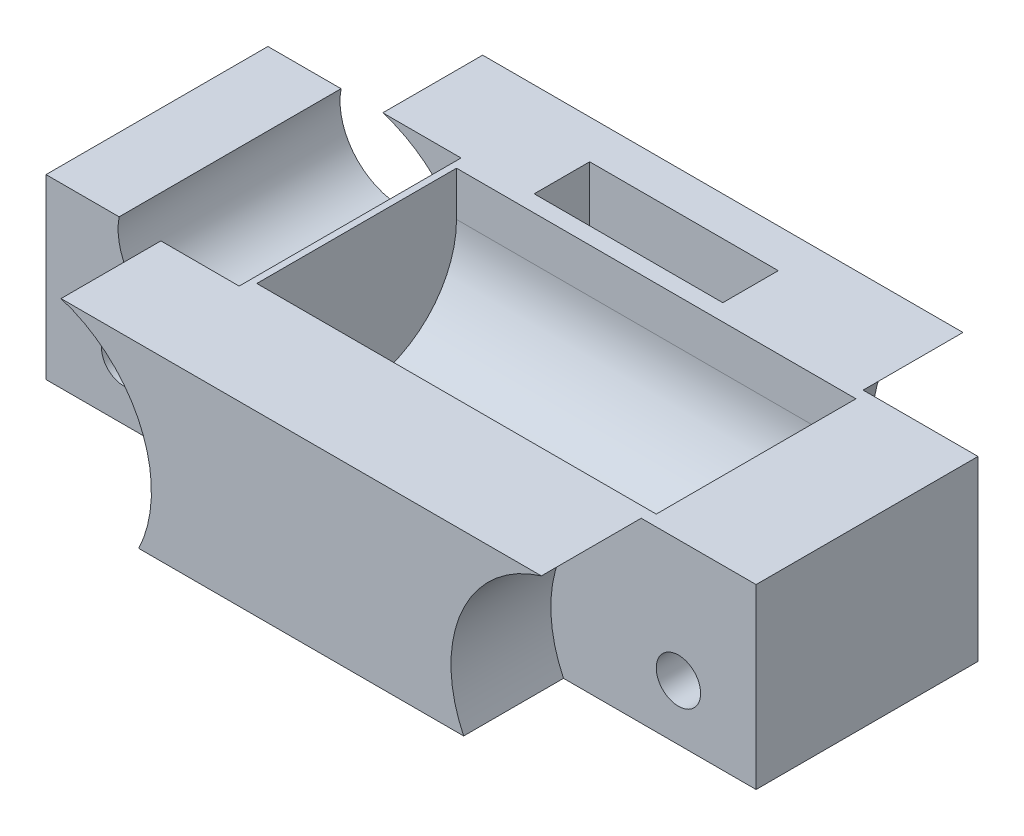
from build123d import *

# Parameters (mm, degrees)
SKETCH1_W               = 64
SKETCH1_H               = 38
BOSS_EXTRUDE1_DEPTH     = 16
CUT_EXTRUDE2_START      = 10
SKETCH3_R               = 11.5
CUT_EXTRUDE2_DEPTH      = 10
CUT_EXTRUDE3_DEPTH      = 41.509258201
CUT_EXTRUDE3_DEPTH_BACK = 41.509258201
SKETCH5_R               = 2
BATTERY_DEPTH           = 22
BATTERY_DEPTH_BACK      = 14
SKETCH4_R               = 9
CUT_EXTRUDE4_REACH      = 45.509
CUT_EXTRUDE4_START      = 3
SKETCH6_W               = 17
SKETCH6_H               = 5
SKETCH7_W               = 12
SKETCH7_H               = 8
CUT_EXTRUDE5_DEPTH      = 3
FILLET1_R               = 1.5
SKETCH8_R               = 5.5
CUT_EXTRUDE6_DEPTH      = 10


with BuildPart() as part:
    # Sketch1 → Boss-Extrude1 (new body)
    with BuildSketch(Plane(origin=(0, 0, 0), x_dir=(1, 0, 0), z_dir=(0, 1, 0))):
        Rectangle(SKETCH1_W, SKETCH1_H)
    extrude(amount=BOSS_EXTRUDE1_DEPTH)

    # Sketch3 → Cut-Extrude2 (cut)
    with BuildSketch(Plane.XY.offset(CUT_EXTRUDE2_START)):
        with BuildLine():
            Line((36.5, -6.5), (36.5, 5))
            ThreePointArc((36.5, 5), (33.131727984, -3.131727984), (25, -6.5))
            Line((25, -6.5), (36.5, -6.5))
        make_face()
        with Locations((25, 5)):
            Circle(SKETCH3_R)
        with BuildLine():
            Line((36.5, 16.5), (25, 16.5))
            ThreePointArc((25, 16.5), (33.131727984, 13.131727984), (36.5, 5))
            Line((36.5, 5), (36.5, 16.5))
        make_face()
        with Locations((-25, 5)):
            Circle(SKETCH3_R)
        with BuildLine():
            Line((-36.5, -6.5), (-25, -6.5))
            ThreePointArc((-25, -6.5), (-33.131727957, -3.13172801), (-36.5, 4.999999925))
            Line((-36.5, 4.999999925), (-36.5, -6.5))
        make_face()
        with BuildLine():
            Line((-36.5, 16.5), (-36.5, 4.999999925))
            ThreePointArc((-36.5, 4.999999925), (-33.13172801, 13.131727957), (-25, 16.5))
            Line((-25, 16.5), (-36.5, 16.5))
        make_face()
    cut_extrude2 = extrude(amount=CUT_EXTRUDE2_DEPTH, mode=Mode.SUBTRACT)

    # Mirror1: Cut-Extrude2 across plane
    add(cut_extrude2.mirror(Plane.XY), mode=Mode.SUBTRACT)

    # Sketch5 → Cut-Extrude3 (cut, two sides: drawn at the far end of the back side and taken through both)
    with BuildSketch(Plane.XY.offset(-CUT_EXTRUDE3_DEPTH_BACK)):
        with Locations((25, 5)):
            Circle(SKETCH5_R)
        with Locations((-25, 5)):
            Circle(SKETCH5_R)
    extrude(amount=CUT_EXTRUDE3_DEPTH + CUT_EXTRUDE3_DEPTH_BACK, mode=Mode.SUBTRACT)


with BuildPart() as body_2:
    # Sketch4 → Battery (new, two sides: drawn at the far end of the back side and taken through both)
    with BuildSketch(Plane(origin=(0, 0, 0), x_dir=(0, 0, -1), z_dir=(1, 0, 0)).offset(-BATTERY_DEPTH_BACK)):
        with Locations((0, 12)):
            Circle(SKETCH4_R)
        with BuildLine():
            Line((-9, 23.052760149), (-9, 12))
            ThreePointArc((-9, 12), (0, 21), (9, 12))
            Line((9, 12), (9, 23.052760149))
            Line((9, 23.052760149), (-9, 23.052760149))
        make_face()
    extrude(amount=BATTERY_DEPTH + BATTERY_DEPTH_BACK)


with BuildPart() as part_1:
    add(part.part)

    # Combine1: cut body 2
    add(body_2.part, mode=Mode.SUBTRACT)

    # Sketch6 → Cut-Extrude4 (cut, up to next)
    with BuildSketch(Plane(origin=(0, 0, 0), x_dir=(1, 0, 0), z_dir=(0, 1, 0)).offset(CUT_EXTRUDE4_START), mode=Mode.PRIVATE) as cut_extrude4_sk1:
        with Locations((0, 13)):
            Rectangle(SKETCH6_W, SKETCH6_H)
    cut_extrude4_tool1 = extrude(cut_extrude4_sk1.sketch, amount=CUT_EXTRUDE4_REACH, mode=Mode.PRIVATE) & part_1.part
    add(cut_extrude4_tool1.solids().sort_by_distance((0, 3, -13))[0], mode=Mode.SUBTRACT)

    # Sketch7 → Cut-Extrude5 (cut)
    with BuildSketch(Plane.XZ):
        with Locations((0, -13)):
            Rectangle(SKETCH7_W, SKETCH7_H)
    extrude(amount=-CUT_EXTRUDE5_DEPTH, mode=Mode.SUBTRACT)

    # Fillet1
    fillet1_edges = [part_1.edges().sort_by_distance(p)[0] for p in [
        (0, 3, -17),
        (0, 3, -9),
    ]]
    fillet(fillet1_edges, radius=FILLET1_R - 0.0001)  # a hair under: the kernel refuses the full size

    # Sketch8 → Cut-Extrude6 (cut, symmetric)
    with BuildSketch(Plane.XY):
        with Locations((-20, 15)):
            Circle(SKETCH8_R)
    extrude(amount=CUT_EXTRUDE6_DEPTH, both=True, mode=Mode.SUBTRACT)


solid = part_1.part
